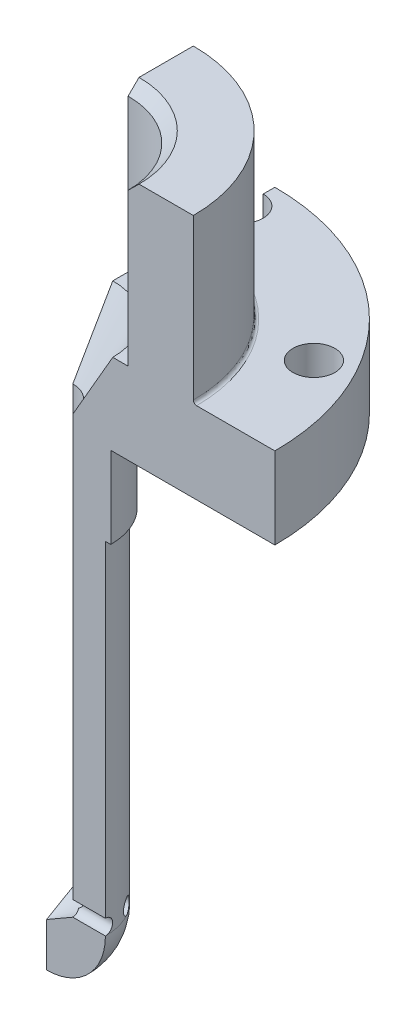
from build123d import *

# Parameters (mm, degrees)
SKETCH1_W           = 2.54
SKETCH1_H           = 26.61158
SKETCH3_R           = 4.5847
SKETCH3_R_2         = 2.0447
BOSS_EXTRUDE1_DEPTH = 6.35
BOSS_EXTRUDE2_START = 6.35
SKETCH4_R           = 17.78
SKETCH4_R_2         = 2.0447
BOSS_EXTRUDE2_DEPTH = 6.35
CUT_EXTRUDE2_REACH  = 48.665
SKETCH11_R          = 1.63195
CIRPATTERN2_COUNT   = 6
CHAMFER1_SIZE       = 3.11277
CHAMFER1_SIZE2      = 5.391475792
SKETCH13_R          = 11.43
SKETCH13_R_2        = 6.35
BOSS_EXTRUDE4_DEPTH = 12.7
FILLET4_R           = 0.254
CHAMFER2_SIZE       = 0.851662
CHAMFER2_SIZE2      = 0.83947
SKETCH15_R          = 4.99999
SKETCH15_R_2        = 3.556
BOSS_EXTRUDE5_DEPTH = 6.35
CUT_EXTRUDE3_REACH  = 58.272
SKETCH20_R          = 0.59563
CIRPATTERN3_COUNT   = 12
CUT_EXTRUDE4_DEPTH  = 62.93057169


with BuildPart() as part:
    # Sketch1 → Revolve2 (revolve)
    with BuildSketch(Plane.XY, mode=Mode.PRIVATE) as revolve2_sk:
        with Locations((-3.3147, 9.772984136)):
            Rectangle(SKETCH1_W, SKETCH1_H)
    revolve(revolve2_sk.sketch.rotate(Axis((0, 8.215698649, 0), (0, -1, 0)), 270), axis=Axis((0, 8.215698649, 0), (0, -1, 0)))

    # Sketch3 → Boss-Extrude1 (add)
    with BuildSketch(Plane(origin=(0, 23.078774136, 0), x_dir=(-1, 0, 0), z_dir=(0, -1, 0))):
        with Locations(Location((0, 0, 0), (0, 0, 270))):
            Circle(SKETCH3_R)
        with Locations(Location((0, 0, 0), (0, 0, 270))):
            Circle(SKETCH3_R_2, mode=Mode.SUBTRACT)
    extrude(amount=-BOSS_EXTRUDE1_DEPTH)

    # Sketch4 → Boss-Extrude2 (add)
    with BuildSketch(Plane(origin=(0, 29.428774136, 0), x_dir=(1, 0, 0), z_dir=(0, 1, 0)).offset(BOSS_EXTRUDE2_START)):
        with Locations(Location((0, 0, 0), (0, 0, 270))):
            Circle(SKETCH4_R)
        with Locations(Location((0, 0, 0), (0, 0, 270))):
            Circle(SKETCH4_R_2, mode=Mode.SUBTRACT)
    extrude(amount=-BOSS_EXTRUDE2_DEPTH)

    # Sketch11 → Cut-Extrude2 (cut, up to next)
    with BuildSketch(Plane(origin=(0, 35.778774136, 0), x_dir=(1, 0, 0), z_dir=(0, 1, 0)), mode=Mode.PRIVATE) as cut_extrude2_sk1:
        with Locations(Location((0, -15.24, 0), (0, 0, 270))):
            Circle(SKETCH11_R)
    cut_extrude2_tool1 = extrude(cut_extrude2_sk1.sketch, amount=-CUT_EXTRUDE2_REACH, mode=Mode.PRIVATE) & part.part
    cut_extrude2 = cut_extrude2_tool1.solids().sort_by_distance((0, 35.778774, 15.24))[0]
    add(cut_extrude2, mode=Mode.SUBTRACT)

    # CirPattern2: Cut-Extrude2 ×6 about axis
    cirpattern2_axis = Axis((0, 0, 0), (0, 1, 0))
    for i in range(1, CIRPATTERN2_COUNT):
        add(cut_extrude2.rotate(cirpattern2_axis, i * 360 / CIRPATTERN2_COUNT), mode=Mode.SUBTRACT)

    # Chamfer1
    chamfer1_edges = [part.edges().sort_by_distance(p)[0] for p in [
        (0, 35.778774136, -2.0447),
    ]]
    chamfer1_side = [part.faces().sort_by_distance(p)[0] for p in [
        (0, 35.778774136, -17.277105657),
    ]]
    chamfer(chamfer1_edges, length=CHAMFER1_SIZE, length2=CHAMFER1_SIZE2, reference=chamfer1_side[0])

    # Sketch13 → Boss-Extrude4 (add)
    with BuildSketch(Plane(origin=(0, 35.778774136, 0), x_dir=(1, 0, 0), z_dir=(0, 1, 0))):
        with Locations(Location((0, 0, 0), (0, 0, 270))):
            Circle(SKETCH13_R)
        with Locations(Location((0, 0, 0), (0, 0, 270))):
            Circle(SKETCH13_R_2, mode=Mode.SUBTRACT)
    extrude(amount=BOSS_EXTRUDE4_DEPTH)

    # Fillet4
    fillet4_edges = [part.edges().sort_by_distance(p)[0] for p in [
        (0, 35.778774136, -11.43),
    ]]
    fillet(fillet4_edges, radius=FILLET4_R)

    # Chamfer2
    chamfer2_edges = [part.edges().sort_by_distance(p)[0] for p in [
        (0, 48.478774136, -6.35),
    ]]
    chamfer2_side = [part.faces().sort_by_distance(p)[0] for p in [
        (0, 48.478774136, -11.10671078),
    ]]
    chamfer(chamfer2_edges, length=CHAMFER2_SIZE, length2=CHAMFER2_SIZE2, reference=chamfer2_side[0])

    # Sketch15 → Boss-Extrude5 (add)
    with BuildSketch(Plane.XZ.offset(-29.428774136)):
        with Locations(Location((0, 0, 0), (0, 0, 90))):
            Circle(SKETCH15_R)
        Circle(SKETCH15_R_2, mode=Mode.SUBTRACT)
    extrude(amount=BOSS_EXTRUDE5_DEPTH)

    # Sketch19 → Revolve4 (revolve)
    with BuildSketch(Plane.XY):
        with BuildLine():
            Line((0, -3.532805864), (-4.5847, -3.532805864))
            ThreePointArc((-4.5847, -3.532805864), (-3.24187246, -6.774678324), (0, -8.117505864))
            Line((0, -8.117505864), (0, -3.532805864))
        make_face()
    revolve(axis=Axis((0, -3.532805864, 0), (0, -1, 0)))

    # Sketch20 → Cut-Extrude3 (cut, up to next)
    with BuildSketch(Plane.ZY.offset(4.5847), mode=Mode.PRIVATE) as cut_extrude3_sk1:
        with Locations(Location((0, -2.937175864, 0), (0, 0, 270.000000007))):
            Circle(SKETCH20_R)
    cut_extrude3_tool1 = extrude(cut_extrude3_sk1.sketch, amount=-CUT_EXTRUDE3_REACH, mode=Mode.PRIVATE) & part.part
    cut_extrude3 = cut_extrude3_tool1.solids().sort_by_distance((-4.5847, -2.937176, 0))[0]
    add(cut_extrude3, mode=Mode.SUBTRACT)

    # CirPattern3: Cut-Extrude3 ×12 about axis
    cirpattern3_axis = Axis((0, -3.532805864, 0), (0, -1, 0))
    for i in range(1, CIRPATTERN3_COUNT):
        add(cut_extrude3.rotate(cirpattern3_axis, i * 360 / CIRPATTERN3_COUNT), mode=Mode.SUBTRACT)

    # Sketch21 → Cut-Revolve4 (revolve, cut)
    with BuildSketch(Plane.XY, mode=Mode.PRIVATE) as cut_revolve4_sk:
        Polygon((0, -3.532805864), (-2.0447, -3.532805864), (0, -4.71331396), align=None)
    revolve(cut_revolve4_sk.sketch.rotate(Axis((0, -3.532805864, 0), (0, -1, 0)), 90), axis=Axis((0, -3.532805864, 0), (0, -1, 0)), mode=Mode.SUBTRACT)

    # Sketch22 → Cut-Extrude4 (cut, through all)
    with BuildSketch(Plane(origin=(0, 48.478774136, 0), x_dir=(1, 0, 0), z_dir=(0, 1, 0))):
        Polygon((0, 0), (0, 19.892792237), (-23.522788241, 19.892792237), (-23.522788241, -23.886235836), (22.70199559, -23.886235836), (22.70199559, 0), align=None)
    extrude(amount=-CUT_EXTRUDE4_DEPTH, mode=Mode.SUBTRACT)


solid = part.part
